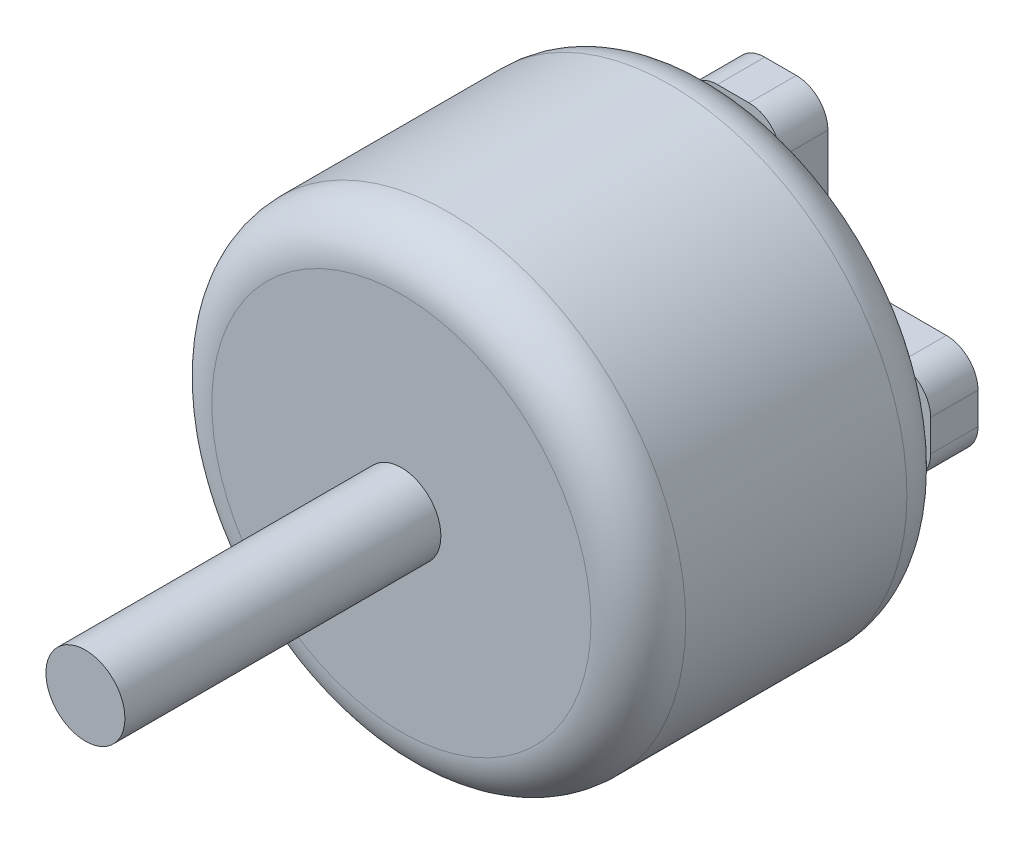
from build123d import *

# Parameters (mm, degrees)
SKETCH1_R           = 1.6
BOSS_EXTRUDE1_DEPTH = 3
SKETCH2_R           = 2.852011264
BOSS_EXTRUDE2_DEPTH = 1
SKETCH3_R           = 15
BOSS_EXTRUDE3_DEPTH = 20
SKETCH4_R           = 2.5
BOSS_EXTRUDE4_DEPTH = 20
FILLET1_R           = 3


with BuildPart() as part:
    # Sketch1 → Boss-Extrude1 (new body)
    with BuildSketch(Plane.XY):
        with BuildLine():
            Line((-71.781745931, -74.781745931), (-67.281745931, -74.781745931))
            ThreePointArc((-67.281745931, -74.781745931), (-65.867532368, -75.367532368), (-65.281745931, -76.781745931))
            Line((-65.281745931, -76.781745931), (-65.281745931, -78.781745931))
            ThreePointArc((-65.281745931, -78.781745931), (-65.867532368, -80.195959493), (-67.281745931, -80.781745931))
            Line((-67.281745931, -80.781745931), (-71.781745931, -80.781745931))
            ThreePointArc((-71.781745931, -80.781745931), (-73.903066274, -81.660425587), (-74.781745931, -83.781745931))
            Line((-74.781745931, -83.781745931), (-74.781745931, -88.281745931))
            ThreePointArc((-74.781745931, -88.281745931), (-75.367532368, -89.695959493), (-76.781745931, -90.281745931))
            Line((-76.781745931, -90.281745931), (-78.781745931, -90.281745931))
            ThreePointArc((-78.781745931, -90.281745931), (-80.195959493, -89.695959493), (-80.781745931, -88.281745931))
            Line((-80.781745931, -88.281745931), (-80.781745931, -83.781745931))
            ThreePointArc((-80.781745931, -83.781745931), (-81.660425587, -81.660425587), (-83.781745931, -80.781745931))
            Line((-83.781745931, -80.781745931), (-88.281745931, -80.781745931))
            ThreePointArc((-88.281745931, -80.781745931), (-89.695959493, -80.195959493), (-90.281745931, -78.781745931))
            Line((-90.281745931, -78.781745931), (-90.281745931, -76.781745931))
            ThreePointArc((-90.281745931, -76.781745931), (-89.695959493, -75.367532368), (-88.281745931, -74.781745931))
            Line((-88.281745931, -74.781745931), (-83.781745931, -74.781745931))
            ThreePointArc((-83.781745931, -74.781745931), (-81.660425587, -73.903066274), (-80.781745931, -71.781745931))
            Line((-80.781745931, -71.781745931), (-80.781745931, -67.281745931))
            ThreePointArc((-80.781745931, -67.281745931), (-80.195959493, -65.867532368), (-78.781745931, -65.281745931))
            Line((-78.781745931, -65.281745931), (-76.781745931, -65.281745931))
            ThreePointArc((-76.781745931, -65.281745931), (-75.367532368, -65.867532368), (-74.781745931, -67.281745931))
            Line((-74.781745931, -67.281745931), (-74.781745931, -71.781745931))
            ThreePointArc((-74.781745931, -71.781745931), (-73.903066274, -73.903066274), (-71.781745931, -74.781745931))
        make_face()
        with Locations((-77.781745931, -68.281745931)):
            Circle(SKETCH1_R, mode=Mode.SUBTRACT)
        with Locations((-68.281745931, -77.781745931)):
            Circle(SKETCH1_R, mode=Mode.SUBTRACT)
        with Locations((-77.781745931, -87.281745931)):
            Circle(SKETCH1_R, mode=Mode.SUBTRACT)
        with Locations((-87.281745931, -77.781745931)):
            Circle(SKETCH1_R, mode=Mode.SUBTRACT)
    extrude(amount=BOSS_EXTRUDE1_DEPTH)

    # Sketch2 → Boss-Extrude2 (add)
    with BuildSketch(Plane.XY.offset(3)):
        with Locations((-77.781745931, -77.781745931)):
            Circle(SKETCH2_R)
    extrude(amount=BOSS_EXTRUDE2_DEPTH)

    # Sketch3 → Boss-Extrude3 (add)
    with BuildSketch(Plane.XY.offset(4)):
        with Locations((-77.781745931, -77.781745931)):
            Circle(SKETCH3_R)
    extrude(amount=BOSS_EXTRUDE3_DEPTH)

    # Sketch4 → Boss-Extrude4 (add)
    with BuildSketch(Plane.XY.offset(24)):
        with Locations((-77.781745931, -77.781745931)):
            Circle(SKETCH4_R)
    extrude(amount=BOSS_EXTRUDE4_DEPTH)

    # Fillet1
    fillet1_edges = [part.edges().sort_by_distance(p)[0] for p in [
        (-92.781745931, -77.781745931, 24),
        (-92.781745931, -77.781745931, 4),
    ]]
    fillet(fillet1_edges, radius=FILLET1_R)


solid = part.part
